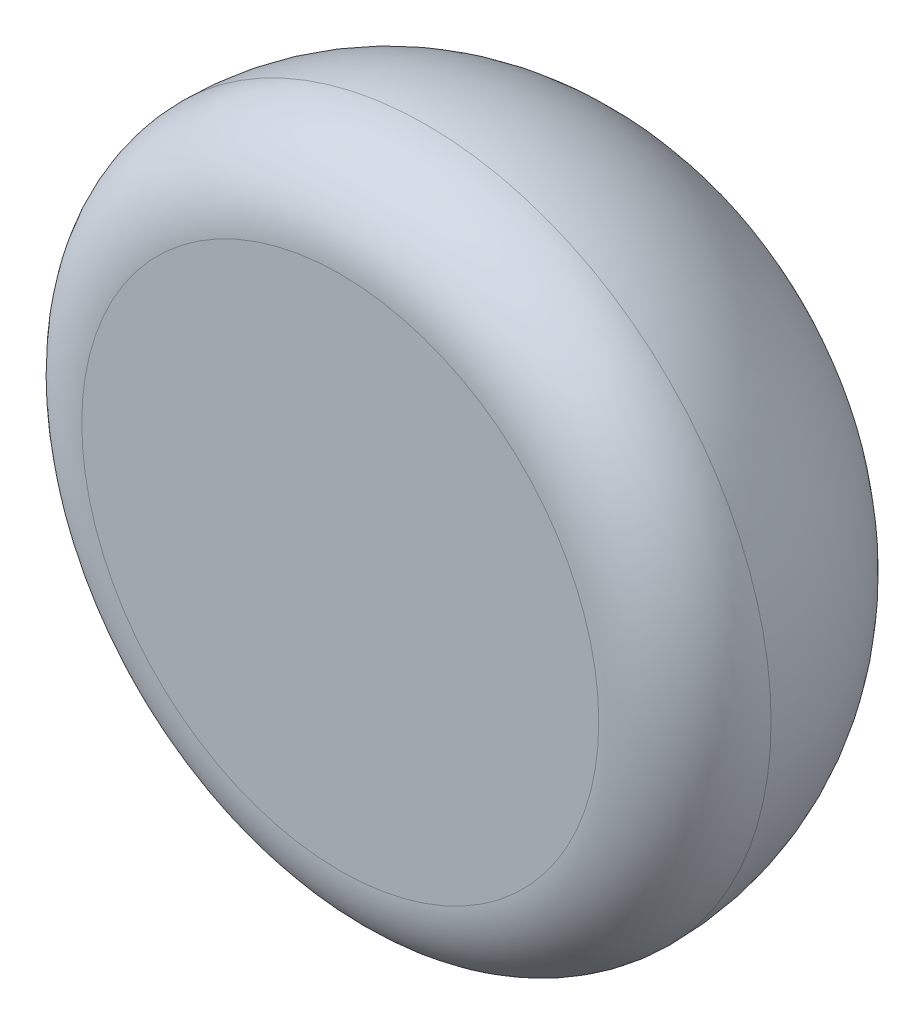
from build123d import *

# Parameters (mm, degrees)
EXTRUDE_3_OUTLINE_R   = 8
EXTRUDE_3_OUTLINE_R_2 = 1.904306864
EXTRUDE_3_OUTLINE_R_3 = 1.884306864
EXTRUDE_3_DEPTH       = 4
EXTRUDE_START         = -1
SKETCH_4_3_R          = 8
SKETCH_4_3_R_2        = 1.904306864
EXTRUDE_4_DEPTH       = 1
SKETCH_5_R            = 8
EXTRUDE_5_DEPTH       = 3
FILLET_3_R            = 2
FILLET_4_R            = 6


# Read off the part's stored shape, not the designer's step: 凸台-拉伸3
with BuildPart() as part:
    # 凸台-拉伸3 outline → 凸台-拉伸3 (new body)
    # profile 1 of 2: a face of its own
    with BuildSketch(Plane.XY.offset(15.156605354)):
        with Locations((62.088098202, 10.274465036)):
            Circle(EXTRUDE_3_OUTLINE_R)
        with Locations((62.088098202, 10.274465036)):
            Circle(EXTRUDE_3_OUTLINE_R_2, mode=Mode.SUBTRACT)
    # profile 2 of 2: a face of its own
    with BuildSketch(Plane.XY.offset(15.156605354)):
        with Locations((62.088098202, 10.274465036)):
            Circle(EXTRUDE_3_OUTLINE_R_3)
        Polygon((62.846382474, 11.544465036), (63.358098202, 11.032749307), (63.358098202, 9.516180765), (62.846382474, 9.004465036), (61.329813931, 9.004465036), (60.818098202, 9.516180765), (60.818098202, 11.032749307), (61.329813931, 11.544465036), align=None, mode=Mode.SUBTRACT)
    extrude(amount=EXTRUDE_3_DEPTH)

    # 草图4<3> → 凸台-拉伸4 (add)
    with BuildSketch(Plane.XY.offset(15.156605354).offset(EXTRUDE_START)):
        with Locations((62.088098202, 10.274465036)):
            Circle(SKETCH_4_3_R)
        with Locations((62.088098202, 10.274465036)):
            Circle(SKETCH_4_3_R_2, mode=Mode.SUBTRACT)
    extrude(amount=EXTRUDE_4_DEPTH)

    # 草图5 → 凸台-拉伸5 (add)
    with BuildSketch(Plane.XY.offset(19.156605354)):
        with Locations((62.088098202, 10.274465036)):
            Circle(SKETCH_5_R)
    extrude(amount=EXTRUDE_5_DEPTH)

    # 圆角3
    fillet_3_edges = [part.edges().sort_by_distance(p)[0] for p in [
        (54.088098202, 10.274465036, 22.156605354),
    ]]
    fillet(fillet_3_edges, radius=FILLET_3_R)

    # 圆角4
    fillet_4_edges = [part.edges().sort_by_distance(p)[0] for p in [
        (54.088098202, 10.274465036, 14.156605354),
    ]]
    fillet(fillet_4_edges, radius=FILLET_4_R - 0.0001)  # a hair under: the kernel refuses the full size


solid = part.part
